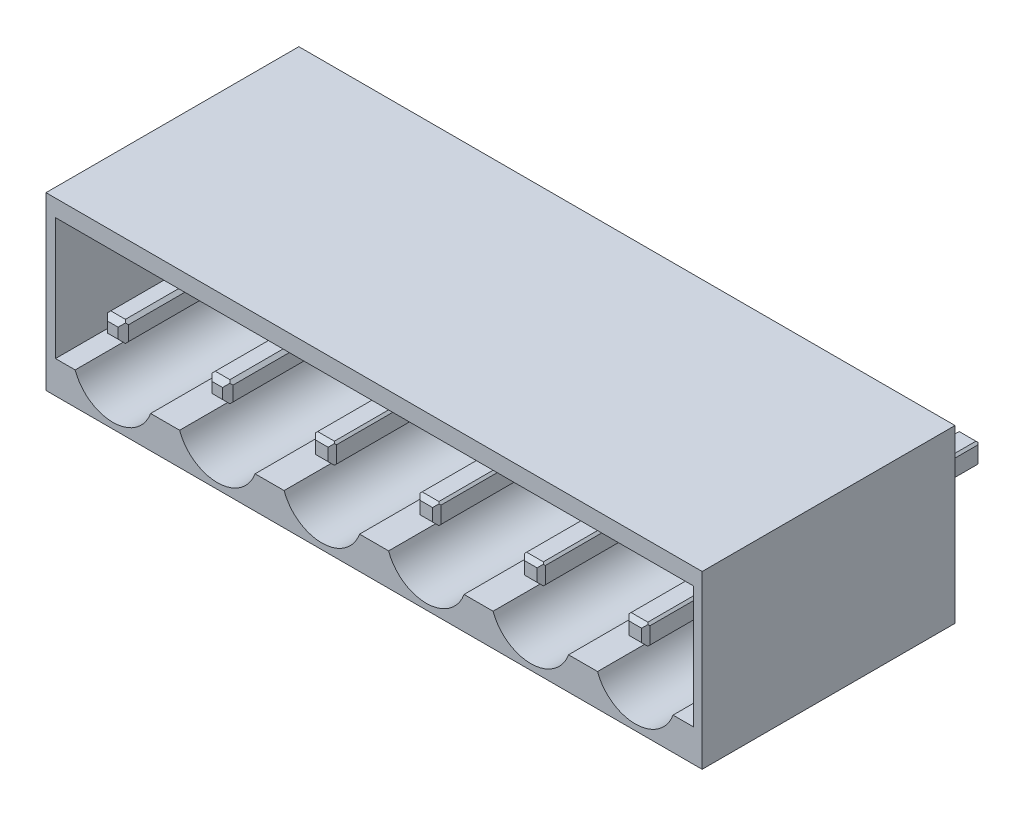
from build123d import *

# Parameters (mm, degrees)
SKETCH_1_W          = 31.4
SKETCH_1_H          = 8.2
EXTRUDE_1_DEPTH     = 12.1
SKETCH_4_R          = 1.25
CUT_EXTRUDE_3_DEPTH = 8
CUT_EXTRUDE_4_DEPTH = 7.8
SKETCH_7_W          = 1
SKETCH_7_H          = 1
EXTRUDE_2_DEPTH     = 8
CHAMFER_1_SIZE      = 0.15
CHAMFER_2_SIZE      = 0.25
SKETCH_8_W          = 1
SKETCH_8_H          = 1
EXTRUDE_3_DEPTH     = 4
CHAMFER_6_SIZE      = 0.1
CHAMFER_7_SIZE      = 0.2
CHAMFER_10_SIZE     = 0.1
CHAMFER_11_SIZE     = 0.2
CHAMFER_12_SIZE     = 0.1
CHAMFER_13_SIZE     = 0.2
CHAMFER_14_SIZE     = 0.1
CHAMFER_15_SIZE     = 0.2


with BuildPart() as part:
    # Эскиз1 → Бобышка-Вытянуть1 (new body)
    with BuildSketch(Plane.XY):
        Rectangle(SKETCH_1_W, SKETCH_1_H)
    extrude(amount=EXTRUDE_1_DEPTH)

    # Эскиз4 → Вырез-Вытянуть3 (cut)
    with BuildSketch(Plane.XY.offset(12.1)):
        with Locations((-12.5, 0)):
            Circle(SKETCH_4_R)
        with Locations((-7.5, 0)):
            Circle(SKETCH_4_R)
        with Locations((-2.5, 0)):
            Circle(SKETCH_4_R)
        with Locations((2.5, 0)):
            Circle(SKETCH_4_R)
        with Locations((7.5, 0)):
            Circle(SKETCH_4_R)
        with Locations((12.5, 0)):
            Circle(SKETCH_4_R)
    extrude(amount=-CUT_EXTRUDE_3_DEPTH, mode=Mode.SUBTRACT)

    # Эскиз5 → Вырез-Вытянуть4 (cut)
    with BuildSketch(Plane.XY.offset(12.1)):
        with BuildLine():
            Line((-15.245621634, 0), (-15.245621634, 3.292901982))
            Line((-15.245621634, 3.292901982), (-4.721490456, 3.292901982))
            Line((-4.721490456, 3.292901982), (0.278509544, 3.292901982))
            Line((0.278509544, 3.292901982), (5.278509544, 3.292901982))
            Line((5.278509544, 3.292901982), (15.278509544, 3.292901982))
            Line((15.278509544, 3.292901982), (15.278509544, -2.548957219))
            Line((15.278509544, -2.548957219), (14.30582632, -2.548957219))
            ThreePointArc((14.30582632, -2.548957219), (12.5, -3.818893996), (10.69417368, -2.548957219))
            Line((10.69417368, -2.548957219), (9.30582632, -2.548957219))
            ThreePointArc((9.30582632, -2.548957219), (7.5, -3.818893996), (5.69417368, -2.548957219))
            Line((5.69417368, -2.548957219), (4.30582632, -2.548957219))
            ThreePointArc((4.30582632, -2.548957219), (2.5, -3.818893996), (0.69417368, -2.548957219))
            Line((0.69417368, -2.548957219), (-0.69417368, -2.548957219))
            ThreePointArc((-0.69417368, -2.548957219), (-2.5, -3.818893996), (-4.30582632, -2.548957219))
            Line((-4.30582632, -2.548957219), (-5.69417368, -2.548957219))
            ThreePointArc((-5.69417368, -2.548957219), (-7.5, -3.818893996), (-9.30582632, -2.548957219))
            Line((-9.30582632, -2.548957219), (-10.69417368, -2.548957219))
            ThreePointArc((-10.69417368, -2.548957219), (-12.5, -3.818893996), (-14.30582632, -2.548957219))
            Line((-14.30582632, -2.548957219), (-15.245621634, -2.548957219))
            Line((-15.245621634, -2.548957219), (-15.245621634, 0))
        make_face()
    extrude(amount=-CUT_EXTRUDE_4_DEPTH, mode=Mode.SUBTRACT)

    # Эскиз7 → Бобышка-Вытянуть2 (add)
    with BuildSketch(Plane.XY.offset(4.1)):
        with Locations((-7.5, 0)):
            Rectangle(SKETCH_7_W, SKETCH_7_H)
        with Locations((-12.5, 0)):
            Rectangle(SKETCH_7_W, SKETCH_7_H)
        with Locations((-2.5, 0)):
            Rectangle(SKETCH_7_W, SKETCH_7_H)
        with Locations((2.5, 0)):
            Rectangle(SKETCH_7_W, SKETCH_7_H)
        with Locations((7.5, 0)):
            Rectangle(SKETCH_7_W, SKETCH_7_H)
        with Locations((12.5, 0)):
            Rectangle(SKETCH_7_W, SKETCH_7_H)
    extrude(amount=EXTRUDE_2_DEPTH)

    # Фаска1
    chamfer_1_edges = [part.edges().sort_by_distance(p)[0] for p in [
        (-12, -0.5, 8.1),
        (-12, 0.5, 8.1),
        (-13, 0.5, 8.1),
        (-13, -0.5, 8.1),
        (-7, -0.5, 8.1),
        (-7, 0.5, 8.1),
        (-8, 0.5, 8.1),
        (-8, -0.5, 8.1),
    ]]
    chamfer(chamfer_1_edges, length=CHAMFER_1_SIZE)

    # Фаска2
    # the kernel refuses this chamfer: 0.25 mm, written as the material it takes off along each edge
    with BuildSketch(Plane(origin=(-8, -0.992920747, 12.1), x_dir=(-0.027495876610589005, 0, -0.9996219169112968), z_dir=(0, 1, 0)), Plane(origin=(-8.492920747, 0.5, 12.1), x_dir=(0, 0.027495876610586414, -0.9996219169112968), z_dir=(1, 0, 0)), Plane(origin=(-7, 0.992920747, 12.1), x_dir=(0.02749587661058555, 0, -0.9996219169112968), z_dir=(0, -1, 0)), Plane(origin=(-6.507079253, -0.5, 12.1), x_dir=(0, -0.027495876610586414, -0.9996219169112968), z_dir=(-1, 0, 0)), Plane(origin=(-12, 0.992920747, 12.1), x_dir=(0.027495876610589005, 0, -0.9996219169112968), z_dir=(0, -1, 0)), Plane(origin=(-11.507079253, -0.5, 12.1), x_dir=(0, -0.027495876610586414, -0.9996219169112968), z_dir=(-1, 0, 0)), Plane(origin=(-13, -0.992920747, 12.1), x_dir=(-0.027495876610589005, 0, -0.9996219169112968), z_dir=(0, 1, 0)), Plane(origin=(-13.492920747, 0.5, 12.1), x_dir=(0, 0.027495876610586414, -0.9996219169112968), z_dir=(1, 0, 0))) as chamfer_2_piece_1:
        Polygon((CHAMFER_2_SIZE * 0.999621916911, -CHAMFER_2_SIZE * 0.0274958766106), (-CHAMFER_2_SIZE * 0.0274958766106, -CHAMFER_2_SIZE * 0.999621916911), (0, 0), align=None)
    extrude(amount=1.985841494, mode=Mode.SUBTRACT)

    # Эскиз8 → Бобышка-Вытянуть3 (add)
    with BuildSketch(Plane(origin=(0, -4.1, 0), x_dir=(-1, 0, 0), z_dir=(0, 0, 1))):
        with Locations((7.5, -3.75)):
            Rectangle(SKETCH_8_W, SKETCH_8_H)
        with Locations((12.5, -3.75)):
            Rectangle(SKETCH_8_W, SKETCH_8_H)
        with Locations((2.5, -3.75)):
            Rectangle(SKETCH_8_W, SKETCH_8_H)
        with Locations((-2.5, -3.75)):
            Rectangle(SKETCH_8_W, SKETCH_8_H)
        with Locations((-7.5, -3.75)):
            Rectangle(SKETCH_8_W, SKETCH_8_H)
        with Locations((-12.5, -3.75)):
            Rectangle(SKETCH_8_W, SKETCH_8_H)
    extrude(amount=-EXTRUDE_3_DEPTH)

    # Фаска6
    chamfer_6_edges = [part.edges().sort_by_distance(p)[0] for p in [
        (-2, -0.5, 8.1),
        (-2, 0.5, 8.1),
        (-3, 0.5, 8.1),
        (-3, -0.5, 8.1),
    ]]
    chamfer(chamfer_6_edges, length=CHAMFER_6_SIZE)

    # Фаска7
    # the kernel refuses this chamfer: 0.2 mm, written as the material it takes off along each edge
    with BuildSketch(Plane(origin=(-2, 0.914336598, 12.1), x_dir=(0.02749587661058634, 0, -0.9996219169112966), z_dir=(0, -1, 0)), Plane(origin=(-1.585663402, -0.5, 12.1), x_dir=(0, -0.02749587661058634, -0.9996219169112966), z_dir=(-1, 0, 0)), Plane(origin=(-3, -0.914336598, 12.1), x_dir=(-0.02749587661058742, 0, -0.9996219169112966), z_dir=(0, 1, 0)), Plane(origin=(-3.414336598, 0.5, 12.1), x_dir=(0, 0.02749587661058634, -0.9996219169112966), z_dir=(1, 0, 0))) as chamfer_7_piece_1:
        Polygon((CHAMFER_7_SIZE * 0.999621916911, -CHAMFER_7_SIZE * 0.0274958766106), (-CHAMFER_7_SIZE * 0.0274958766106, -CHAMFER_7_SIZE * 0.999621916911), (0, 0), align=None)
    extrude(amount=1.828673195, mode=Mode.SUBTRACT)

    # Фаска10
    chamfer_10_edges = [part.edges().sort_by_distance(p)[0] for p in [
        (-12, 0.15, -2),
        (-12, -0.85, -2),
        (-13, -0.85, -2),
        (-13, 0.15, -2),
        (-7, 0.15, -2),
        (-7, -0.85, -2),
        (-8, -0.85, -2),
        (-8, 0.15, -2),
        (-2, 0.15, -2),
        (-2, -0.85, -2),
        (-3, -0.85, -2),
        (-3, 0.15, -2),
    ]]
    chamfer(chamfer_10_edges, length=CHAMFER_10_SIZE)

    # Фаска11
    # the kernel refuses this chamfer: 0.2 mm, written as the material it takes off along each edge
    with BuildSketch(Plane(origin=(-12, 0.564336598, -4), x_dir=(0.027495876610587302, 0, 0.9996219169112966), z_dir=(0, -1, 0)), Plane(origin=(-13.414336598, 0.15, -4), x_dir=(0, 0.027495876610586355, 0.9996219169112966), z_dir=(1, 0, 0)), Plane(origin=(-13, -1.264336598, -4), x_dir=(-0.027495876610587302, 0, 0.9996219169112966), z_dir=(0, 1, 0)), Plane(origin=(-11.585663402, -0.85, -4), x_dir=(0, -0.027495876610586223, 0.9996219169112966), z_dir=(-1, 0, 0)), Plane(origin=(-6.585663402, -0.85, -4), x_dir=(0, -0.027495876610586223, 0.9996219169112966), z_dir=(-1, 0, 0)), Plane(origin=(-8, -1.264336598, -4), x_dir=(-0.027495876610587302, 0, 0.9996219169112966), z_dir=(0, 1, 0)), Plane(origin=(-8.414336598, 0.15, -4), x_dir=(0, 0.027495876610586355, 0.9996219169112966), z_dir=(1, 0, 0)), Plane(origin=(-7, 0.564336598, -4), x_dir=(0.027495876610587302, 0, 0.9996219169112966), z_dir=(0, -1, 0)), Plane(origin=(-3, -1.264336598, -4), x_dir=(-0.027495876610587302, 0, 0.9996219169112966), z_dir=(0, 1, 0)), Plane(origin=(-3.414336598, 0.15, -4), x_dir=(0, 0.027495876610586355, 0.9996219169112966), z_dir=(1, 0, 0)), Plane(origin=(-2, 0.564336598, -4), x_dir=(0.027495876610586223, 0, 0.9996219169112966), z_dir=(0, -1, 0)), Plane(origin=(-1.585663402, -0.85, -4), x_dir=(0, -0.027495876610586223, 0.9996219169112966), z_dir=(-1, 0, 0))) as chamfer_11_piece_1:
        Polygon((CHAMFER_11_SIZE * 0.999621916911, CHAMFER_11_SIZE * 0.0274958766106), (-CHAMFER_11_SIZE * 0.0274958766106, CHAMFER_11_SIZE * 0.999621916911), (0, 0), align=None)
    extrude(amount=1.828673195, mode=Mode.SUBTRACT)

    # Фаска12
    chamfer_12_edges = [part.edges().sort_by_distance(p)[0] for p in [
        (8, -0.5, 8.1),
        (8, 0.5, 8.1),
        (7, 0.5, 8.1),
        (7, -0.5, 8.1),
        (13, -0.5, 8.1),
        (13, 0.5, 8.1),
        (12, 0.5, 8.1),
        (12, -0.5, 8.1),
        (3, 0.15, -2),
        (3, -0.85, -2),
        (2, -0.85, -2),
        (2, 0.15, -2),
        (8, 0.15, -2),
        (8, -0.85, -2),
        (7, -0.85, -2),
        (7, 0.15, -2),
        (13, 0.15, -2),
        (13, -0.85, -2),
        (12, -0.85, -2),
        (12, 0.15, -2),
    ]]
    chamfer(chamfer_12_edges, length=CHAMFER_12_SIZE)

    # Фаска13
    # the kernel refuses this chamfer: 0.2 mm, written as the material it takes off along each edge
    with BuildSketch(Plane(origin=(1.585663402, 0.15, -4), x_dir=(0, 0.027495876610586355, 0.9996219169112966), z_dir=(1, 0, 0)), Plane(origin=(3, 0.564336598, -4), x_dir=(0.027495876610587302, 0, 0.9996219169112966), z_dir=(0, -1, 0)), Plane(origin=(2, -1.264336598, -4), x_dir=(-0.027495876610586223, 0, 0.9996219169112966), z_dir=(0, 1, 0)), Plane(origin=(3.414336598, -0.85, -4), x_dir=(0, -0.027495876610586223, 0.9996219169112966), z_dir=(-1, 0, 0))) as chamfer_13_piece_1:
        Polygon((CHAMFER_13_SIZE * 0.999621916911, CHAMFER_13_SIZE * 0.0274958766106), (-CHAMFER_13_SIZE * 0.0274958766106, CHAMFER_13_SIZE * 0.999621916911), (0, 0), align=None)
    extrude(amount=1.828673195, mode=Mode.SUBTRACT)

    # Фаска14
    chamfer_14_edges = [part.edges().sort_by_distance(p)[0] for p in [
        (3, -0.5, 8.1),
        (3, 0.5, 8.1),
        (2, 0.5, 8.1),
        (2, -0.5, 8.1),
    ]]
    chamfer(chamfer_14_edges, length=CHAMFER_14_SIZE)

    # Фаска15
    # the kernel refuses this chamfer: 0.2 mm, written as the material it takes off along each edge
    with BuildSketch(Plane(origin=(2, -0.914336598, 12.1), x_dir=(-0.02749587661058634, 0, -0.9996219169112966), z_dir=(0, 1, 0)), Plane(origin=(3.414336598, -0.5, 12.1), x_dir=(0, -0.02749587661058634, -0.9996219169112966), z_dir=(-1, 0, 0)), Plane(origin=(3, 0.914336598, 12.1), x_dir=(0.02749587661058742, 0, -0.9996219169112966), z_dir=(0, -1, 0)), Plane(origin=(1.585663402, 0.5, 12.1), x_dir=(0, 0.02749587661058634, -0.9996219169112966), z_dir=(1, 0, 0)), Plane(origin=(13, 0.914336598, 12.1), x_dir=(0.02749587661058742, 0, -0.9996219169112966), z_dir=(0, -1, 0)), Plane(origin=(13.414336598, -0.5, 12.1), x_dir=(0, -0.02749587661058634, -0.9996219169112966), z_dir=(-1, 0, 0)), Plane(origin=(12, -0.914336598, 12.1), x_dir=(-0.02749587661058742, 0, -0.9996219169112966), z_dir=(0, 1, 0)), Plane(origin=(11.585663402, 0.5, 12.1), x_dir=(0, 0.02749587661058634, -0.9996219169112966), z_dir=(1, 0, 0)), Plane(origin=(8.414336598, -0.5, 12.1), x_dir=(0, -0.02749587661058634, -0.9996219169112966), z_dir=(-1, 0, 0)), Plane(origin=(8, 0.914336598, 12.1), x_dir=(0.02749587661058742, 0, -0.9996219169112966), z_dir=(0, -1, 0)), Plane(origin=(7, -0.914336598, 12.1), x_dir=(-0.02749587661058742, 0, -0.9996219169112966), z_dir=(0, 1, 0)), Plane(origin=(6.585663402, 0.5, 12.1), x_dir=(0, 0.02749587661058634, -0.9996219169112966), z_dir=(1, 0, 0))) as chamfer_15_piece_1:
        Polygon((CHAMFER_15_SIZE * 0.999621916911, -CHAMFER_15_SIZE * 0.0274958766106), (-CHAMFER_15_SIZE * 0.0274958766106, -CHAMFER_15_SIZE * 0.999621916911), (0, 0), align=None)
    extrude(amount=1.828673195, mode=Mode.SUBTRACT)
    with BuildSketch(Plane(origin=(7, -1.264336598, -4), x_dir=(-0.027495876610587302, 0, 0.9996219169112966), z_dir=(0, 1, 0)), Plane(origin=(8.414336598, -0.85, -4), x_dir=(0, -0.027495876610586223, 0.9996219169112966), z_dir=(-1, 0, 0)), Plane(origin=(8, 0.564336598, -4), x_dir=(0.027495876610587302, 0, 0.9996219169112966), z_dir=(0, -1, 0)), Plane(origin=(6.585663402, 0.15, -4), x_dir=(0, 0.027495876610586355, 0.9996219169112966), z_dir=(1, 0, 0)), Plane(origin=(12, -1.264336598, -4), x_dir=(-0.027495876610587302, 0, 0.9996219169112966), z_dir=(0, 1, 0)), Plane(origin=(13.414336598, -0.85, -4), x_dir=(0, -0.027495876610586223, 0.9996219169112966), z_dir=(-1, 0, 0)), Plane(origin=(13, 0.564336598, -4), x_dir=(0.027495876610587302, 0, 0.9996219169112966), z_dir=(0, -1, 0)), Plane(origin=(11.585663402, 0.15, -4), x_dir=(0, 0.027495876610586355, 0.9996219169112966), z_dir=(1, 0, 0))) as chamfer_15_piece_2:
        Polygon((CHAMFER_15_SIZE * 0.999621916911, CHAMFER_15_SIZE * 0.0274958766106), (-CHAMFER_15_SIZE * 0.0274958766106, CHAMFER_15_SIZE * 0.999621916911), (0, 0), align=None)
    extrude(amount=1.828673195, mode=Mode.SUBTRACT)


solid = part.part
